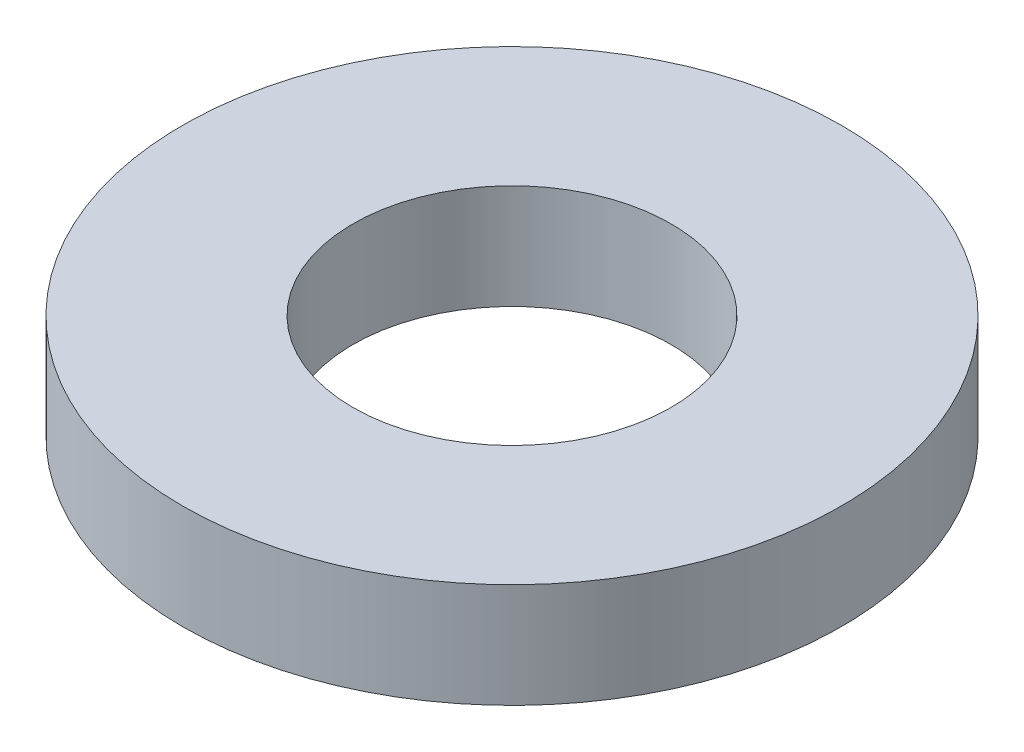
from build123d import *

# Parameters (mm, degrees)
SKETCH1_R           = 72.5
BOSS_EXTRUDE1_DEPTH = 23
SKETCH2_R           = 35
CUT_EXTRUDE1_DEPTH  = 106.078542053


with BuildPart() as part:
    # Sketch1 → Boss-Extrude1 (new body)
    with BuildSketch(Plane(origin=(0, 0, 0), x_dir=(1, 0, 0), z_dir=(0, 1, 0))):
        Circle(SKETCH1_R)
    extrude(amount=BOSS_EXTRUDE1_DEPTH)

    # Sketch2 → Cut-Extrude1 (cut, through all)
    with BuildSketch(Plane(origin=(0, 0, 0), x_dir=(1, 0, 0), z_dir=(0, 1, 0))):
        Circle(SKETCH2_R)
    extrude(amount=CUT_EXTRUDE1_DEPTH, mode=Mode.SUBTRACT)


solid = part.part
